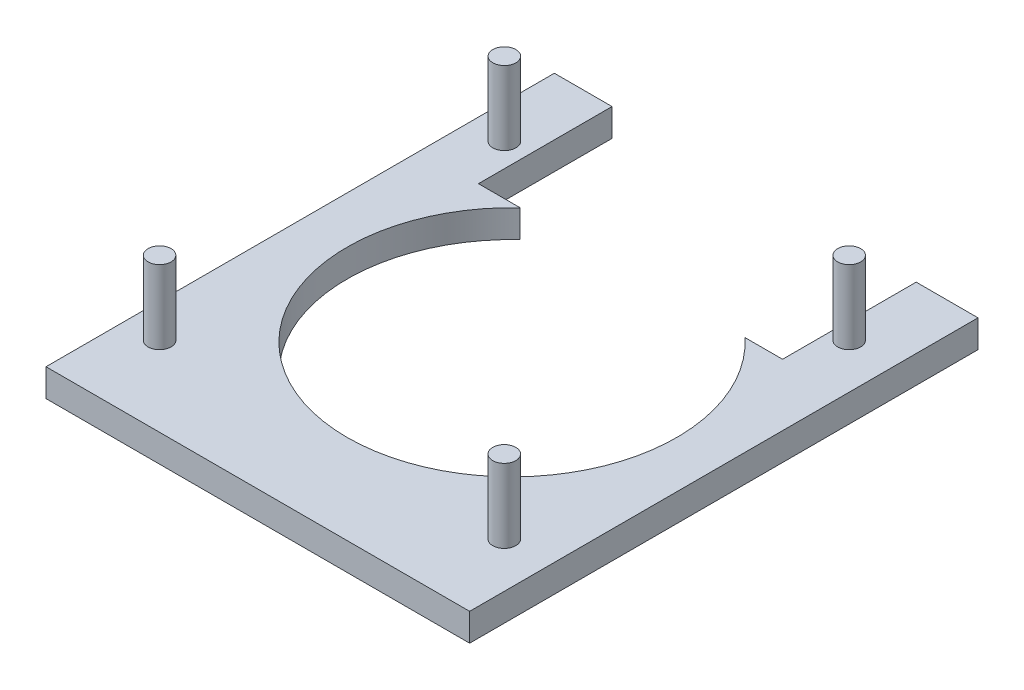
from build123d import *

# Parameters (mm, degrees)
SKETCH1_W           = 46
SKETCH1_H           = 55.2
BOSS_EXTRUDE1_DEPTH = 3
SKETCH4_W           = 33.02335113
SKETCH4_H           = 20.828153407
CUT_EXTRUDE1_DEPTH  = 8
SKETCH3_R           = 17.9
CUT_EXTRUDE2_DEPTH  = 8
SKETCH5_R           = 1.25
BOSS_EXTRUDE2_DEPTH = 8


with BuildPart() as part:
    # Sketch1 → Boss-Extrude1 (new body)
    with BuildSketch(Plane(origin=(0, 0, 0), x_dir=(1, 0, 0), z_dir=(0, 1, 0))):
        Rectangle(SKETCH1_W, SKETCH1_H)
    extrude(amount=BOSS_EXTRUDE1_DEPTH)

    # Sketch4 → Cut-Extrude1 (cut)
    with BuildSketch(Plane(origin=(0, 3, 0), x_dir=(1, 0, 0), z_dir=(0, 1, 0))):
        with Locations((-0.224140392, 23.506208916)):
            Rectangle(SKETCH4_W, SKETCH4_H)
    extrude(amount=-CUT_EXTRUDE1_DEPTH, mode=Mode.SUBTRACT)

    # Sketch3 → Cut-Extrude2 (cut)
    with BuildSketch(Plane(origin=(0, 3, 0), x_dir=(1, 0, 0), z_dir=(0, 1, 0))):
        Circle(SKETCH3_R)
    extrude(amount=-CUT_EXTRUDE2_DEPTH, mode=Mode.SUBTRACT)

    # Sketch5 → Boss-Extrude2 (add)
    with BuildSketch(Plane(origin=(0, 3, 0), x_dir=(1, 0, 0), z_dir=(0, 1, 0))):
        with Locations((-19.317913276, 18.489975821)):
            Circle(SKETCH5_R)
        with Locations((18.122086724, 18.489975821)):
            Circle(SKETCH5_R)
        with Locations((-19.317913276, -18.950024179)):
            Circle(SKETCH5_R)
        with Locations((18.084134894, -18.924464602)):
            Circle(SKETCH5_R)
    extrude(amount=BOSS_EXTRUDE2_DEPTH)


solid = part.part
